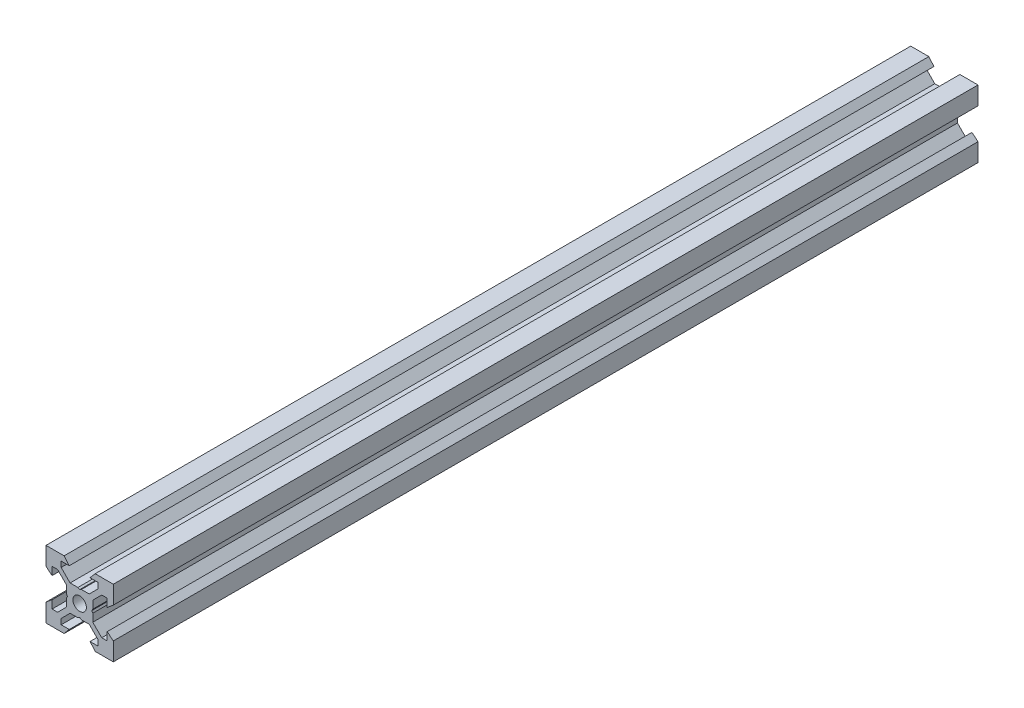
from build123d import *

# Parameters (mm, degrees)
SKETCH1_R           = 2
BOSS_EXTRUDE1_DEPTH = 128.5


with BuildPart() as part:
    # Sketch1 → Boss-Extrude1 (new, symmetric)
    with BuildSketch(Plane.XY):
        Polygon((10, 4.610379336), (10, 10), (4.610379336, 10), (3.1, 8.2), (5.5, 8.2), (5.5, 6.560660172), (2.839339828, 3.9), (0.519615242, 3.9), (0, 3.6), (-0.519615242, 3.9), (-2.839339828, 3.9), (-5.5, 6.560660172), (-5.5, 8.2), (-3.1, 8.2), (-4.610379336, 10), (-10, 10), (-10, 4.610379336), (-8.2, 3.1), (-8.2, 5.5), (-6.560660172, 5.5), (-3.9, 2.839339828), (-3.9, 0.519615242), (-3.6, 0), (-3.9, -0.519615242), (-3.9, -2.839339828), (-6.560660172, -5.5), (-8.2, -5.5), (-8.2, -3.1), (-10, -4.610379336), (-10, -10), (-4.610379336, -10), (-3.1, -8.2), (-5.5, -8.2), (-5.5, -6.560660172), (-2.839339828, -3.9), (-0.519615242, -3.9), (0, -3.6), (0.519615242, -3.9), (2.839339828, -3.9), (5.5, -6.560660172), (5.5, -8.2), (3.1, -8.2), (4.610379336, -10), (10, -10), (10, -4.610379336), (8.2, -3.1), (8.2, -5.5), (6.560660172, -5.5), (3.9, -2.839339828), (3.9, -0.519615242), (3.6, 0), (3.9, 0.519615242), (3.9, 2.839339828), (6.560660172, 5.5), (8.2, 5.5), (8.2, 3.1), align=None)
        Circle(SKETCH1_R, mode=Mode.SUBTRACT)
    extrude(amount=BOSS_EXTRUDE1_DEPTH, both=True)


solid = part.part
